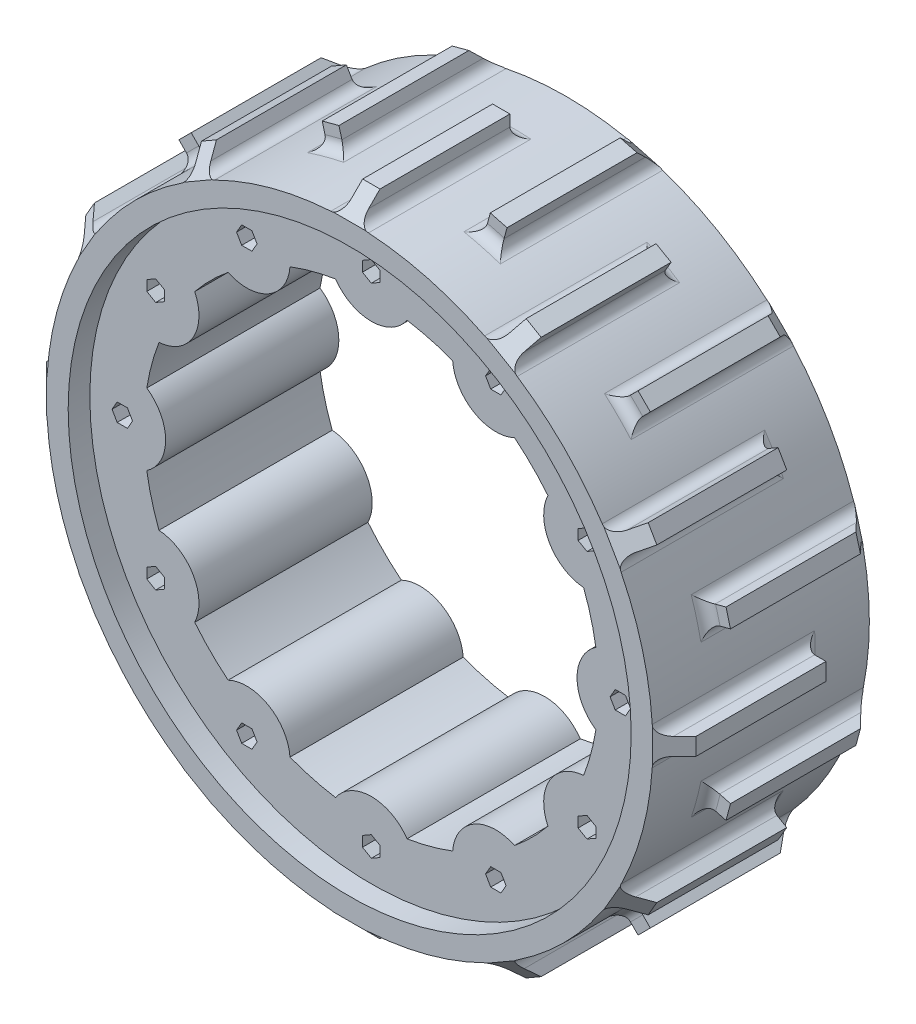
from build123d import *

# Parameters (mm, degrees)
SKETCH_1_R          = 140
EXTRUDE_1_DEPTH     = 100
SKETCH_2_R          = 105
CUT_EXTRUDE_1_DEPTH = 100
SKETCH_3_R          = 20
EXTRUDE_2_DEPTH     = 100
SKETCH_4_R          = 130
CUT_EXTRUDE_2_DEPTH = 10
CUT_EXTRUDE_START   = -10
SKETCH_5_R          = 130
CUT_EXTRUDE_3_DEPTH = 10
CUT_EXTRUDE_4_DEPTH = 218.485631709
SKETCH_7_W          = 8
SKETCH_7_H          = 10
SKETCH_7_W_2        = 10
SKETCH_7_H_2        = 8
EXTRUDE_3_DEPTH     = 70
EXTRUDE_4_DEPTH     = 70
FILLET_3_R          = 5
CHAMFER_1_SIZE      = 10


with BuildPart() as part:
    # 草图1 → 凸台-拉伸1 (new body)
    with BuildSketch(Plane.XY):
        Circle(SKETCH_1_R)
    extrude(amount=EXTRUDE_1_DEPTH)

    # 草图2 → 切除-拉伸1 (cut)
    with BuildSketch(Plane.XY.offset(100)):
        Circle(SKETCH_2_R)
    extrude(amount=-CUT_EXTRUDE_1_DEPTH, mode=Mode.SUBTRACT)

    # 草图3 → 凸台-拉伸2 (add, through all)
    with BuildSketch(Plane.XY.offset(100)):
        with Locations((0, 115)):
            Circle(SKETCH_3_R)
        with Locations((57.5, 99.592921435)):
            Circle(SKETCH_3_R)
        with Locations((99.592921435, 57.5)):
            Circle(SKETCH_3_R)
        with Locations((115, 0)):
            Circle(SKETCH_3_R)
        with Locations((99.592921435, -57.5)):
            Circle(SKETCH_3_R)
        with Locations((57.5, -99.592921435)):
            Circle(SKETCH_3_R)
        with Locations((0, -115)):
            Circle(SKETCH_3_R)
        with Locations((-57.5, -99.592921435)):
            Circle(SKETCH_3_R)
        with Locations((-99.592921435, -57.5)):
            Circle(SKETCH_3_R)
        with Locations((-115, 0)):
            Circle(SKETCH_3_R)
        with Locations((-99.592921435, 57.5)):
            Circle(SKETCH_3_R)
        with Locations((-57.5, 99.592921435)):
            Circle(SKETCH_3_R)
    extrude(amount=-EXTRUDE_2_DEPTH)

    # 草图4 → 切除-拉伸2 (cut)
    with BuildSketch(Plane.XY.offset(100)):
        Circle(SKETCH_4_R)
    extrude(amount=-CUT_EXTRUDE_2_DEPTH, mode=Mode.SUBTRACT)

    # 草图5 → 切除-拉伸3 (cut)
    with BuildSketch(Plane(origin=(0, 0, 0), x_dir=(-1, 0, 0), z_dir=(0, 0, -1)).offset(CUT_EXTRUDE_START)):
        with Locations(Location((0, 0, 0), (0, 0, 180))):
            Circle(SKETCH_5_R)
    extrude(amount=CUT_EXTRUDE_3_DEPTH, mode=Mode.SUBTRACT)

    # 草图6 → 切除-拉伸4 (cut, through all)
    with BuildSketch(Plane.XY.offset(90)):
        Polygon((55.132863896, 95.492921435), (59.867136104, 95.492921435), (62.234272207, 99.592921435), (59.867136104, 103.692921435), (55.132863896, 103.692921435), (52.765727793, 99.592921435), align=None)
        Polygon((0, 110.265727793), (4.1, 112.632863896), (4.1, 117.367136104), (0, 119.734272207), (-4.1, 117.367136104), (-4.1, 112.632863896), align=None)
        Polygon((95.492921435, 55.132863896), (99.592921435, 52.765727793), (103.692921435, 55.132863896), (103.692921435, 59.867136104), (99.592921435, 62.234272207), (95.492921435, 59.867136104), align=None)
        Polygon((110.265727793, 0), (112.632863896, -4.1), (117.367136104, -4.1), (119.734272207, 0), (117.367136104, 4.1), (112.632863896, 4.1), align=None)
        Polygon((95.492921435, -55.132863896), (95.492921435, -59.867136104), (99.592921435, -62.234272207), (103.692921435, -59.867136104), (103.692921435, -55.132863896), (99.592921435, -52.765727793), align=None)
        Polygon((55.132863896, -95.492921435), (52.765727793, -99.592921435), (55.132863896, -103.692921435), (59.867136104, -103.692921435), (62.234272207, -99.592921435), (59.867136104, -95.492921435), align=None)
        Polygon((0, -110.265727793), (-4.1, -112.632863896), (-4.1, -117.367136104), (0, -119.734272207), (4.1, -117.367136104), (4.1, -112.632863896), align=None)
        Polygon((-55.132863896, -95.492921435), (-59.867136104, -95.492921435), (-62.234272207, -99.592921435), (-59.867136104, -103.692921435), (-55.132863896, -103.692921435), (-52.765727793, -99.592921435), align=None)
        Polygon((-95.492921435, -55.132863896), (-99.592921435, -52.765727793), (-103.692921435, -55.132863896), (-103.692921435, -59.867136104), (-99.592921435, -62.234272207), (-95.492921435, -59.867136104), align=None)
        Polygon((-110.265727793, 0), (-112.632863896, 4.1), (-117.367136104, 4.1), (-119.734272207, 0), (-117.367136104, -4.1), (-112.632863896, -4.1), align=None)
        Polygon((-95.492921435, 55.132863896), (-95.492921435, 59.867136104), (-99.592921435, 62.234272207), (-103.692921435, 59.867136104), (-103.692921435, 55.132863896), (-99.592921435, 52.765727793), align=None)
        Polygon((-55.132863896, 95.492921435), (-52.765727793, 99.592921435), (-55.132863896, 103.692921435), (-59.867136104, 103.692921435), (-62.234272207, 99.592921435), (-59.867136104, 95.492921435), align=None)
    extrude(amount=-CUT_EXTRUDE_4_DEPTH, mode=Mode.SUBTRACT)

    # 草图7 → 凸台-拉伸3 (add)
    with BuildSketch(Plane.XY.offset(100)):
        Polygon((66.507321123, 123.19405926), (73.435524353, 119.19405926), (78.435524353, 127.854313298), (71.507321123, 131.854313298), align=None)
        with Locations((0, 144.942845476)):
            Rectangle(SKETCH_7_W, SKETCH_7_H)
        Polygon((119.19405926, 73.435524353), (123.19405926, 66.507321123), (131.854313298, 71.507321123), (127.854313298, 78.435524353), align=None)
        with Locations((144.942845476, 0)):
            Rectangle(SKETCH_7_W_2, SKETCH_7_H_2)
        Polygon((123.19405926, -66.507321123), (119.19405926, -73.435524353), (127.854313298, -78.435524353), (131.854313298, -71.507321123), align=None)
        Polygon((73.435524353, -119.19405926), (66.507321123, -123.19405926), (71.507321123, -131.854313298), (78.435524353, -127.854313298), align=None)
        with Locations((0, -144.942845476)):
            Rectangle(SKETCH_7_W, SKETCH_7_H)
        Polygon((-66.507321123, -123.19405926), (-73.435524353, -119.19405926), (-78.435524353, -127.854313298), (-71.507321123, -131.854313298), align=None)
        Polygon((-119.19405926, -73.435524353), (-123.19405926, -66.507321123), (-131.854313298, -71.507321123), (-127.854313298, -78.435524353), align=None)
        with Locations((-144.942845476, 0)):
            Rectangle(SKETCH_7_W_2, SKETCH_7_H_2)
        Polygon((-123.19405926, 66.507321123), (-119.19405926, 73.435524353), (-127.854313298, 78.435524353), (-131.854313298, 71.507321123), align=None)
        Polygon((-73.435524353, 119.19405926), (-66.507321123, 123.19405926), (-71.507321123, 131.854313298), (-78.435524353, 127.854313298), align=None)
    extrude(amount=-EXTRUDE_3_DEPTH)

    # 草图9 → 凸台-拉伸4 (add)
    with BuildSketch(Plane(origin=(0, 0, 0), x_dir=(-1, 0, 0), z_dir=(0, 0, -1))):
        Polygon((34.944360781, 145.868943093), (32.35617033, 136.20968483), (40.08357694, 134.13913247), (42.671767391, 143.798390732), align=None)
        Polygon((101.78296214, 96.12610789), (108.854029951, 103.197175702), (103.197175702, 108.854029951), (96.12610789, 101.78296214), align=None)
        Polygon((136.20968483, 32.35617033), (145.868943093, 34.944360781), (143.798390732, 42.671767391), (134.13913247, 40.08357694), align=None)
        Polygon((134.13913247, -40.08357694), (143.798390732, -42.671767391), (145.868943093, -34.944360781), (136.20968483, -32.35617033), align=None)
        Polygon((96.12610789, -101.78296214), (103.197175702, -108.854029951), (108.854029951, -103.197175702), (101.78296214, -96.12610789), align=None)
        Polygon((32.35617033, -136.20968483), (34.944360781, -145.868943093), (42.671767391, -143.798390732), (40.08357694, -134.13913247), align=None)
        Polygon((-40.08357694, -134.13913247), (-42.671767391, -143.798390732), (-34.944360781, -145.868943093), (-32.35617033, -136.20968483), align=None)
        Polygon((-101.78296214, -96.12610789), (-108.854029951, -103.197175702), (-103.197175702, -108.854029951), (-96.12610789, -101.78296214), align=None)
        Polygon((-136.20968483, -32.35617033), (-145.868943093, -34.944360781), (-143.798390732, -42.671767391), (-134.13913247, -40.08357694), align=None)
        Polygon((-134.13913247, 40.08357694), (-143.798390732, 42.671767391), (-145.868943093, 34.944360781), (-136.20968483, 32.35617033), align=None)
        Polygon((-96.12610789, 101.78296214), (-103.197175702, 108.854029951), (-108.854029951, 103.197175702), (-101.78296214, 96.12610789), align=None)
        Polygon((-32.35617033, 136.20968483), (-34.944360781, 145.868943093), (-42.671767391, 143.798390732), (-40.08357694, 134.13913247), align=None)
    extrude(amount=-EXTRUDE_4_DEPTH)

    # 圆角3
    fillet_3_edges = [part.edges().sort_by_distance(p)[0] for p in [
        (70, 121.24355653, 30),
        (-70, 121.24355653, 30),
        (-121.24355653, 70, 30),
        (-140, 0, 30),
        (0, 140, 30),
        (121.24355653, 70, 30),
        (139.98571064, 2.000204155, 30),
        (121.24355653, -70, 30),
        (70, -121.24355653, 30),
        (0, -140, 30),
        (-70, -121.24355653, 30),
        (-121.24355653, -70, 30),
        (-119.19405926, -73.435524353, 65),
        (-123.19405926, -66.507321123, 65),
        (-66.507321123, -123.19405926, 65),
        (-73.435524353, -119.19405926, 65),
        (4, -139.942845476, 65),
        (-4, -139.942845476, 65),
        (73.435524353, -119.19405926, 65),
        (66.507321123, -123.19405926, 65),
        (123.19405926, -66.507321123, 65),
        (119.19405926, -73.435524353, 65),
        (139.942845476, 4, 65),
        (139.942845476, -4, 65),
        (119.19405926, 73.435524353, 65),
        (123.19405926, 66.507321123, 65),
        (-4, 139.942845476, 65),
        (4, 139.942845476, 65),
        (-139.942845476, -4, 65),
        (-139.942845476, 4, 65),
        (-123.19405926, 66.507321123, 65),
        (-119.19405926, 73.435524353, 65),
        (-73.435524353, 119.19405926, 65),
        (-66.507321123, 123.19405926, 65),
        (66.507321123, 123.19405926, 65),
        (73.435524353, 119.19405926, 65),
        (-36.234666314, 135.22961568, 70),
        (36.234666314, 135.22961568, 70),
        (98.994949366, 98.994949366, 70),
        (135.22961568, 36.234666314, 70),
        (135.22961568, -36.234666314, 70),
        (98.994949366, -98.994949366, 70),
        (36.234666314, -135.22961568, 70),
        (-36.234666314, -135.22961568, 70),
        (-98.994949366, -98.994949366, 70),
        (-135.22961568, -36.234666314, 70),
        (-135.22961568, 36.234666314, 70),
        (-98.994949366, 98.994949366, 70),
        (-96.12610789, 101.78296214, 35),
        (-101.78296214, 96.12610789, 35),
        (-134.13913247, 40.08357694, 35),
        (-136.20968483, 32.35617033, 35),
        (-136.20968483, -32.35617033, 35),
        (-134.13913247, -40.08357694, 35),
        (-101.78296214, -96.12610789, 35),
        (-96.12610789, -101.78296214, 35),
        (-40.08357694, -134.13913247, 35),
        (-32.35617033, -136.20968483, 35),
        (32.35617033, -136.20968483, 35),
        (40.08357694, -134.13913247, 35),
        (96.12610789, -101.78296214, 35),
        (101.78296214, -96.12610789, 35),
        (134.13913247, -40.08357694, 35),
        (136.20968483, -32.35617033, 35),
        (136.20968483, 32.35617033, 35),
        (134.13913247, 40.08357694, 35),
        (101.78296214, 96.12610789, 35),
        (96.12610789, 101.78296214, 35),
        (40.08357694, 134.13913247, 35),
        (32.35617033, 136.20968483, 35),
        (-40.08357694, 134.13913247, 35),
        (-32.35617033, 136.20968483, 35),
    ]]
    fillet(fillet_3_edges, radius=FILLET_3_R)

    # 倒角1
    chamfer_1_edges = [part.edges().sort_by_distance(p)[0] for p in [
        (74.971422738, 129.854313298, 100),
        (106.025602827, 106.025602827, 0),
        (129.854313298, 74.971422738, 100),
        (144.833666913, 38.808064086, 0),
        (149.942845476, 0, 100),
        (144.833666913, -38.808064086, 0),
        (129.854313298, -74.971422738, 100),
        (106.025602827, -106.025602827, 0),
        (74.971422738, -129.854313298, 100),
        (38.808064086, -144.833666913, 0),
        (0, -149.942845476, 100),
        (-38.808064086, -144.833666913, 0),
        (-74.971422738, -129.854313298, 100),
        (-106.025602827, -106.025602827, 0),
        (-129.854313298, -74.971422738, 100),
        (-144.833666913, -38.808064086, 0),
        (-149.942845476, 0, 100),
        (-129.854313298, 74.971422738, 100),
        (-74.971422738, 129.854313298, 100),
        (0, 149.942845476, 100),
        (-144.833666913, 38.808064086, 0),
        (-106.025602827, 106.025602827, 0),
        (-38.808064086, 144.833666913, 0),
        (38.808064086, 144.833666913, 0),
    ]]
    chamfer(chamfer_1_edges, length=CHAMFER_1_SIZE)


solid = part.part
